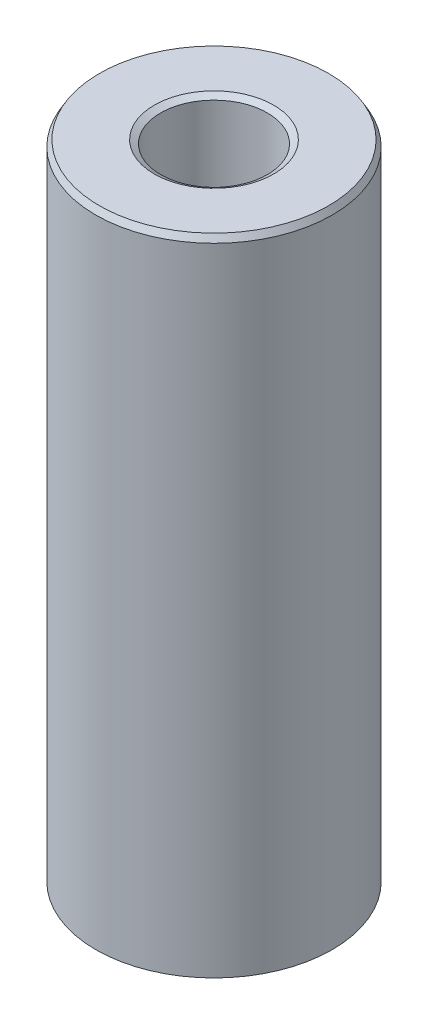
from build123d import *
from OCP.BRepFilletAPI import BRepFilletAPI_MakeChamfer

# Parameters (mm, degrees)
SKETCH1_R           = 60
BOSS_EXTRUDE1_DEPTH = 327.892797996
SKETCH2_R           = 27.119097958
CUT_EXTRUDE1_DEPTH  = 339.694090556
CHAMFER1_SIZE       = 3.176590201
CHAMFER1_SIZE2      = 1.834005208


with BuildPart() as part:
    # Sketch1 → Boss-Extrude1 (new body)
    with BuildSketch(Plane(origin=(0, 0, 0), x_dir=(1, 0, 0), z_dir=(0, 1, 0))):
        Circle(SKETCH1_R)
    extrude(amount=BOSS_EXTRUDE1_DEPTH)

    # Sketch2 → Cut-Extrude1 (cut, through all)
    with BuildSketch(Plane(origin=(0, 0, 0), x_dir=(1, 0, 0), z_dir=(0, 1, 0))):
        Circle(SKETCH2_R)
    extrude(amount=CUT_EXTRUDE1_DEPTH, mode=Mode.SUBTRACT)

    # Chamfer1: one chamfer whose edges measure the first distance from different faces: ONE call of the kernel's chamfer builder (chamfer() names one face for all edges)
    chamfer1_edges_1 = [part.edges().sort_by_distance(p)[0] for p in [
        (-27.119097958, 327.892797996, 0),
    ]]
    chamfer1_side_1 = [part.faces().sort_by_distance(p)[0] for p in [
        (-58.302943725, 327.892797996, 0),
    ]]
    chamfer1_edges_2 = [part.edges().sort_by_distance(p)[0] for p in [
        (-27.119097958, 0, 0),
    ]]
    chamfer1_side_2 = [part.faces().sort_by_distance(p)[0] for p in [
        (-27.119097958, 163.946398998, 0),
    ]]
    chamfer1_edges_3 = [part.edges().sort_by_distance(p)[0] for p in [
        (-60, 0, 0),
    ]]
    chamfer1_side_3 = [part.faces().sort_by_distance(p)[0] for p in [
        (-58.302943725, 0, 0),
    ]]
    chamfer1_edges_4 = [part.edges().sort_by_distance(p)[0] for p in [
        (-60, 327.892797996, 0),
    ]]
    chamfer1_side_4 = [part.faces().sort_by_distance(p)[0] for p in [
        (-60, 163.946398998, 0),
    ]]
    chamfer1 = BRepFilletAPI_MakeChamfer(part.part.solid().wrapped)
    for e in chamfer1_edges_1:
        chamfer1.Add(CHAMFER1_SIZE, CHAMFER1_SIZE2, e.wrapped, chamfer1_side_1[0].wrapped)  # the first distance lies on this face
    for e in chamfer1_edges_2:
        chamfer1.Add(CHAMFER1_SIZE, CHAMFER1_SIZE2, e.wrapped, chamfer1_side_2[0].wrapped)  # the first distance lies on this face
    for e in chamfer1_edges_3:
        chamfer1.Add(CHAMFER1_SIZE, CHAMFER1_SIZE2, e.wrapped, chamfer1_side_3[0].wrapped)  # the first distance lies on this face
    for e in chamfer1_edges_4:
        chamfer1.Add(CHAMFER1_SIZE, CHAMFER1_SIZE2, e.wrapped, chamfer1_side_4[0].wrapped)  # the first distance lies on this face
    add(Compound.cast(chamfer1.Shape()), mode=Mode.REPLACE)


solid = part.part
